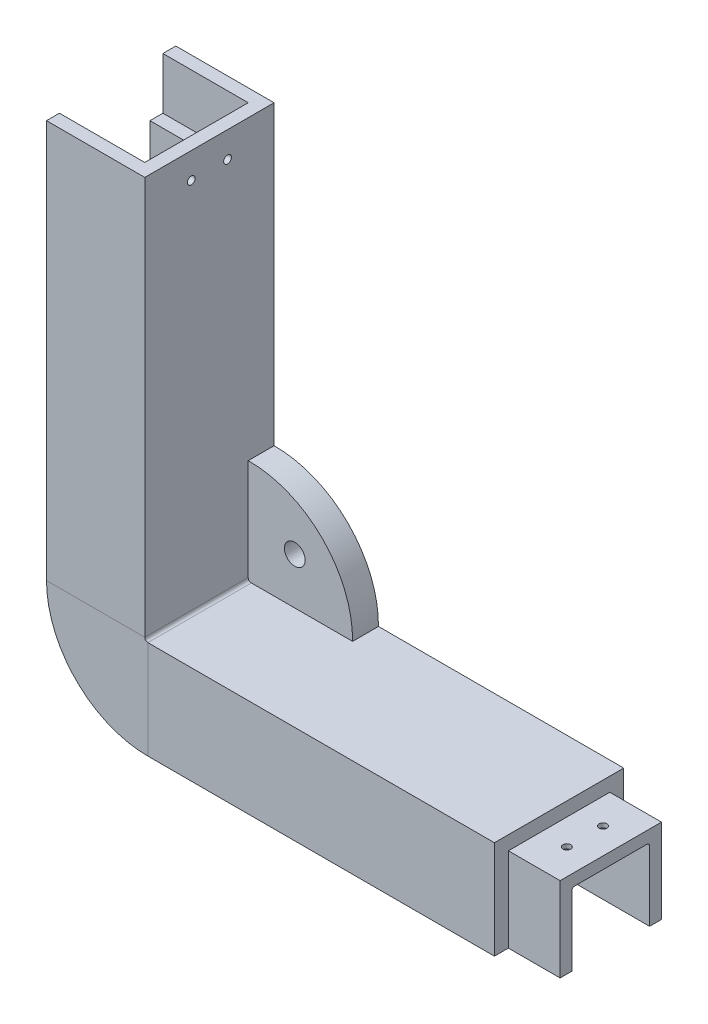
from build123d import *

# Parameters (mm, degrees)
BOSS_EXTRUDE2_START  = 12.7
BOSS_EXTRUDE2_DEPTH  = 12.7
BOSS_EXTRUDE3_DEPTH  = 12.7
SKETCH8_R            = 0.9525
CUT_EXTRUDE1_DEPTH   = 146.526980066
SKETCH9_R            = 0.9525
CUT_EXTRUDE2_DEPTH   = 152.345956246
SKETCH12_R           = 2.5527
BOSS_EXTRUDE10_DEPTH = 6.35


with BuildPart() as part:
    # Sweep1: sweep along a path in Sketch4
    with BuildLine(Plane.XY) as sweep1_path:
        Line((0, 0), (0, -85.09))
        ThreePointArc((0, -85.09), (0.223184633, -85.628815367), (0.762, -85.852))
        Line((0.762, -85.852), (85.852, -85.852))
    # Sketch3 → Sweep1 (sweep)
    with BuildSketch(Plane(origin=(0, 0, 0), x_dir=(1, 0, 0), z_dir=(0, 1, 0))):
        with BuildLine():
            Line((0, 10.27500014), (-24.13, 10.27500014))
            Line((-24.13, 10.27500014), (-24.13, 3.92500014))
            Line((-24.13, 3.92500014), (-6.985, 3.92500014))
            ThreePointArc((-6.985, 3.92500014), (-6.535987194, 3.739012946), (-6.35, 3.29000014))
            Line((-6.35, 3.29000014), (-6.35, -14.48999986))
            ThreePointArc((-6.35, -14.48999986), (-6.535987194, -14.939012666), (-6.985, -15.12499986))
            Line((-6.985, -15.12499986), (-24.13, -15.12499986))
            Line((-24.13, -15.12499986), (-24.13, -21.47499986))
            Line((-24.13, -21.47499986), (0, -21.47499986))
            Line((0, -21.47499986), (0, 10.27500014))
        make_face()
    sweep(path=sweep1_path.line)

    # Sketch6 → Boss-Extrude2 (add)
    with BuildSketch(Plane(origin=(85.852, 0, 0), x_dir=(0, 0, -1), z_dir=(1, 0, 0)).offset(BOSS_EXTRUDE2_START)):
        with BuildLine():
            Line((-18.04599986, -89.281), (6.84600014, -89.281))
            Line((6.84600014, -89.281), (6.84600014, -109.982))
            Line((6.84600014, -109.982), (3.92500014, -109.982))
            Line((3.92500014, -109.982), (3.92500014, -92.837))
            ThreePointArc((3.92500014, -92.837), (3.739012946, -92.387987194), (3.29000014, -92.202))
            Line((3.29000014, -92.202), (-14.48999986, -92.202))
            ThreePointArc((-14.48999986, -92.202), (-14.939012666, -92.387987194), (-15.12499986, -92.837))
            Line((-15.12499986, -92.837), (-15.12499986, -109.982))
            Line((-15.12499986, -109.982), (-18.04599986, -109.982))
            Line((-18.04599986, -109.982), (-18.04599986, -89.281))
        make_face()
    extrude(amount=-BOSS_EXTRUDE2_DEPTH)

    # Sketch7 → Boss-Extrude3 (add)
    with BuildSketch(Plane(origin=(0, 0, 0), x_dir=(1, 0, 0), z_dir=(0, 1, 0))):
        Polygon((-24.13, 7.10000014), (-24.13, 10.27500014), (0, 10.27500014), (0, -21.47499986), (-24.13, -21.47499986), (-24.13, -18.29999986), (-3.175, -18.29999986), (-3.175, 7.10000014), align=None)
    extrude(amount=BOSS_EXTRUDE3_DEPTH)

    # Sketch8 → Cut-Extrude1 (cut, through all)
    with BuildSketch(Plane.XZ.offset(92.202)):
        with Locations((92.202, 10.04499986)):
            Circle(SKETCH8_R)
        with Locations((92.202, 1.15499986)):
            Circle(SKETCH8_R)
    extrude(amount=-CUT_EXTRUDE1_DEPTH, mode=Mode.SUBTRACT)

    # Sketch9 → Cut-Extrude2 (cut, through all)
    with BuildSketch(Plane.ZY.offset(3.175)):
        with Locations((1.15499986, 6.35)):
            Circle(SKETCH9_R)
        with Locations((10.04499986, 6.35)):
            Circle(SKETCH9_R)
    extrude(amount=-CUT_EXTRUDE2_DEPTH, mode=Mode.SUBTRACT)

    # Sketch12 → Boss-Extrude10 (add)
    with BuildSketch(Plane.XY.offset(-10.27500014)):
        with BuildLine():
            Line((0, -60.229795925), (0, -85.09))
            ThreePointArc((0, -85.09), (0.223184633, -85.628815367), (0.762, -85.852))
            Line((0.762, -85.852), (25.622204075, -85.852))
            ThreePointArc((25.622204075, -85.852), (18.183696875, -67.668303125), (0, -60.229795925))
        make_face()
        with Locations((11.43, -74.422)):
            Circle(SKETCH12_R, mode=Mode.SUBTRACT)
    extrude(amount=BOSS_EXTRUDE10_DEPTH)

    # Sketch14 → CSK for _6 Flat Head Machine Screw _100 (revolve, cut)
    with BuildSketch(Plane(origin=(92.202, -92.202, 1.15499986), x_dir=(0, 0, -1), z_dir=(1, 0, 0))):
        Polygon((0, 0), (0, 2.410824014), (1.89865, 1.27), (1.89865, 1.380025208), (3.5433, 0), align=None)
    revolve(axis=Axis((92.202, -98.552, 1.15499986), (0, 1, 0)), mode=Mode.SUBTRACT)

    # Sketch16 → CSK for _6 Flat Head Machine Screw _ 2 (revolve, cut)
    with BuildSketch(Plane(origin=(92.202, -92.202, 10.04499986), x_dir=(0, 0, -1), z_dir=(1, 0, 0))):
        Polygon((0, 0), (0, 2.410824014), (1.89865, 1.27), (1.89865, 1.380025208), (3.5433, 0), align=None)
    revolve(axis=Axis((92.202, -98.552, 10.04499986), (0, 1, 0)), mode=Mode.SUBTRACT)


solid = part.part
